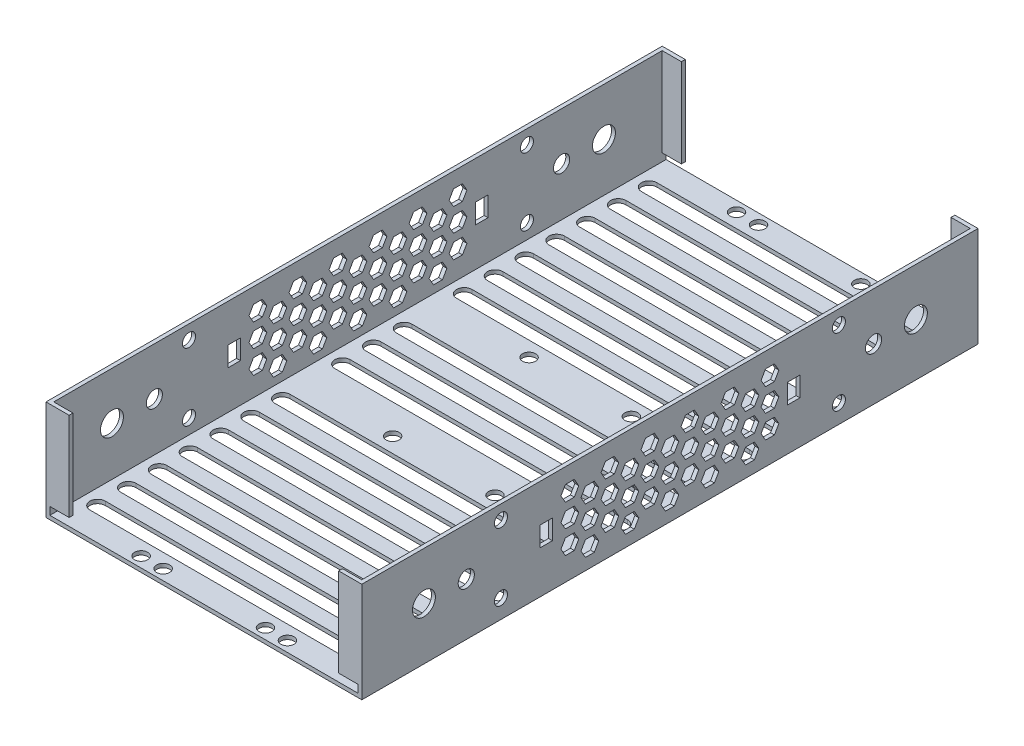
from build123d import *

# Parameters (mm, degrees)
EXTRUDE_START       = 1
SKETCH_1_R          = 1.7
EXTRUDE_1_DEPTH     = 1
SKETCH_3_W          = 160
SKETCH_3_H          = 26
SKETCH_3_R          = 2.98
SKETCH_3_R_2        = 2.1
SKETCH_3_R_3        = 1.7
SKETCH_3_W_2        = 3.245395601
SKETCH_3_H_2        = 5.116955501
EXTRUDE_2_DEPTH     = 1
EXTRUDE_START_2     = -1
SKETCH_11_W         = 160
SKETCH_11_H         = 26
SKETCH_11_R         = 2.98
SKETCH_11_R_2       = 2.1
SKETCH_11_R_3       = 1.7
SKETCH_11_W_2       = 3.245395601
SKETCH_11_H_2       = 5.116955501
EXTRUDE_3_DEPTH     = 1
CUT_EXTRUDE_1_DEPTH = 10
SKETCH_14_W         = 5
SKETCH_14_H         = 23
EXTRUDE_4_DEPTH     = 1
SKETCH_15_W         = 5
SKETCH_15_H         = 23
EXTRUDE_5_DEPTH     = 1
CUT_EXTRUDE_2_DEPTH = 118.698768048


with BuildPart() as part:
    # 草图1 → 凸台-拉伸1 (new body)
    with BuildSketch(Plane(origin=(0, 0, 0), x_dir=(1, 0, 0), z_dir=(0, 1, 0)).offset(EXTRUDE_START)):
        Polygon((-40, 80), (40, 80), (40, -80), (0, -80), (-40, -80), align=None)
        with Locations((-13.28422657, -77.29489459)):
            Circle(SKETCH_1_R, mode=Mode.SUBTRACT)
        with Locations((-13.28422657, -17.70637541)):
            Circle(SKETCH_1_R, mode=Mode.SUBTRACT)
        with Locations((-13.28422657, 77.29489459)):
            Circle(SKETCH_1_R, mode=Mode.SUBTRACT)
        with Locations((-13.28422657, 17.70637541)):
            Circle(SKETCH_1_R, mode=Mode.SUBTRACT)
        with Locations((13.28422657, -77.29489459)):
            Circle(SKETCH_1_R, mode=Mode.SUBTRACT)
        with Locations((13.28422657, -17.70637541)):
            Circle(SKETCH_1_R, mode=Mode.SUBTRACT)
        with Locations((13.28422657, 17.70637541)):
            Circle(SKETCH_1_R, mode=Mode.SUBTRACT)
        with Locations((13.28422657, 77.29489459)):
            Circle(SKETCH_1_R, mode=Mode.SUBTRACT)
        with Locations((19, -77.3)):
            Circle(SKETCH_1_R, mode=Mode.SUBTRACT)
        with Locations((-19, -77.3)):
            Circle(SKETCH_1_R, mode=Mode.SUBTRACT)
        with Locations((19, 77.3)):
            Circle(SKETCH_1_R, mode=Mode.SUBTRACT)
        with Locations((-19, 77.3)):
            Circle(SKETCH_1_R, mode=Mode.SUBTRACT)
    extrude(amount=EXTRUDE_1_DEPTH)

    # 草图3 → 凸台-拉伸2 (add)
    with BuildSketch(Plane(origin=(40, 0, 0), x_dir=(0, 0, -1), z_dir=(1, 0, 0))):
        with Locations((0, 14)):
            Rectangle(SKETCH_3_W, SKETCH_3_H)
        with Locations((-63.873360894, 14.599788345)):
            Circle(SKETCH_3_R, mode=Mode.SUBTRACT)
        with Locations((-52.873360894, 14.599788345)):
            Circle(SKETCH_3_R_2, mode=Mode.SUBTRACT)
        with Locations((52.873360894, 14.599788345)):
            Circle(SKETCH_3_R_2, mode=Mode.SUBTRACT)
        with Locations((63.873360894, 14.599788345)):
            Circle(SKETCH_3_R, mode=Mode.SUBTRACT)
        with Locations((-43.86924386, 23.36782364)):
            Circle(SKETCH_3_R_3, mode=Mode.SUBTRACT)
        with Locations((-43.86924386, 5.83175305)):
            Circle(SKETCH_3_R_3, mode=Mode.SUBTRACT)
        with Locations((43.86924386, 5.83175305)):
            Circle(SKETCH_3_R_3, mode=Mode.SUBTRACT)
        with Locations((43.86924386, 23.36782364)):
            Circle(SKETCH_3_R_3, mode=Mode.SUBTRACT)
        with Locations((-32.136303875, 14.600665152)):
            Rectangle(SKETCH_3_W_2, SKETCH_3_H_2, mode=Mode.SUBTRACT)
        with Locations((32.136303875, 14.600665152)):
            Rectangle(SKETCH_3_W_2, SKETCH_3_H_2, mode=Mode.SUBTRACT)
    extrude(amount=EXTRUDE_2_DEPTH)

    # 草图11 → 凸台-拉伸3 (add)
    with BuildSketch(Plane(origin=(-40, 0, -40), x_dir=(0, 0, -1), z_dir=(1, 0, 0)).offset(EXTRUDE_START_2)):
        with Locations((-40, 14)):
            Rectangle(SKETCH_11_W, SKETCH_11_H)
        with Locations((-103.873360894, 14.599788345)):
            Circle(SKETCH_11_R, mode=Mode.SUBTRACT)
        with Locations((-92.873360894, 14.599788345)):
            Circle(SKETCH_11_R_2, mode=Mode.SUBTRACT)
        with Locations((12.873360894, 14.599788345)):
            Circle(SKETCH_11_R_2, mode=Mode.SUBTRACT)
        with Locations((23.873360894, 14.599788345)):
            Circle(SKETCH_11_R, mode=Mode.SUBTRACT)
        with Locations((-83.86924386, 23.36782364)):
            Circle(SKETCH_11_R_3, mode=Mode.SUBTRACT)
        with Locations((-83.86924386, 5.83175305)):
            Circle(SKETCH_11_R_3, mode=Mode.SUBTRACT)
        with Locations((3.86924386, 5.83175305)):
            Circle(SKETCH_11_R_3, mode=Mode.SUBTRACT)
        with Locations((3.86924386, 23.36782364)):
            Circle(SKETCH_11_R_3, mode=Mode.SUBTRACT)
        with Locations((-72.136303875, 14.600665152)):
            Rectangle(SKETCH_11_W_2, SKETCH_11_H_2, mode=Mode.SUBTRACT)
        with Locations((-7.863696126, 14.600665152)):
            Rectangle(SKETCH_11_W_2, SKETCH_11_H_2, mode=Mode.SUBTRACT)
    extrude(amount=EXTRUDE_3_DEPTH)

    # 草图12 → 切除-拉伸1 (cut)
    with BuildSketch(Plane(origin=(0, 0, 0), x_dir=(1, 0, 0), z_dir=(0, 1, 0))):
        with BuildLine():
            Line((36, 61.605861208), (-36, 61.605861208))
            ThreePointArc((-36, 61.605861208), (-38, 63.605861208), (-36, 65.605861208))
            Line((-36, 65.605861208), (36, 65.605861208))
            ThreePointArc((36, 65.605861208), (38, 63.605861208), (36, 61.605861208))
        make_face()
        with BuildLine():
            Line((36, -2), (-36, -2))
            ThreePointArc((-36, -2), (-38, 0), (-36, 2))
            Line((-36, 2), (36, 2))
            ThreePointArc((36, 2), (38, 0), (36, -2))
        make_face()
        with BuildLine():
            Line((36, 69.605861208), (-36, 69.605861208))
            ThreePointArc((-36, 69.605861208), (-38, 71.605861208), (-36, 73.605861208))
            Line((-36, 73.605861208), (36, 73.605861208))
            ThreePointArc((36, 73.605861208), (38, 71.605861208), (36, 69.605861208))
        make_face()
        with BuildLine():
            Line((36, 53.605861208), (-36, 53.605861208))
            ThreePointArc((-36, 53.605861208), (-38, 55.605861208), (-36, 57.605861208))
            Line((-36, 57.605861208), (36, 57.605861208))
            ThreePointArc((36, 57.605861208), (38, 55.605861208), (36, 53.605861208))
        make_face()
        with BuildLine():
            Line((36, 45.605861208), (-36, 45.605861208))
            ThreePointArc((-36, 45.605861208), (-38, 47.605861208), (-36, 49.605861208))
            Line((-36, 49.605861208), (36, 49.605861208))
            ThreePointArc((36, 49.605861208), (38, 47.605861208), (36, 45.605861208))
        make_face()
        with BuildLine():
            Line((36, 37.605861208), (-36, 37.605861208))
            ThreePointArc((-36, 37.605861208), (-38, 39.605861208), (-36, 41.605861208))
            Line((-36, 41.605861208), (36, 41.605861208))
            ThreePointArc((36, 41.605861208), (38, 39.605861208), (36, 37.605861208))
        make_face()
        with BuildLine():
            Line((36, 29.605861208), (-36, 29.605861208))
            ThreePointArc((-36, 29.605861208), (-38, 31.605861208), (-36, 33.605861208))
            Line((-36, 33.605861208), (36, 33.605861208))
            ThreePointArc((36, 33.605861208), (38, 31.605861208), (36, 29.605861208))
        make_face()
        with BuildLine():
            Line((36, 21.605861208), (-36, 21.605861208))
            ThreePointArc((-36, 21.605861208), (-38, 23.605861208), (-36, 25.605861208))
            Line((-36, 25.605861208), (36, 25.605861208))
            ThreePointArc((36, 25.605861208), (38, 23.605861208), (36, 21.605861208))
        make_face()
        with BuildLine():
            Line((36, -61.605861208), (-36, -61.605861208))
            ThreePointArc((-36, -61.605861208), (-38, -63.605861208), (-36, -65.605861208))
            Line((-36, -65.605861208), (36, -65.605861208))
            ThreePointArc((36, -65.605861208), (38, -63.605861208), (36, -61.605861208))
        make_face()
        with BuildLine():
            Line((36, -69.605861208), (-36, -69.605861208))
            ThreePointArc((-36, -69.605861208), (-38, -71.605861208), (-36, -73.605861208))
            Line((-36, -73.605861208), (36, -73.605861208))
            ThreePointArc((36, -73.605861208), (38, -71.605861208), (36, -69.605861208))
        make_face()
        with BuildLine():
            Line((36, -53.605861208), (-36, -53.605861208))
            ThreePointArc((-36, -53.605861208), (-38, -55.605861208), (-36, -57.605861208))
            Line((-36, -57.605861208), (36, -57.605861208))
            ThreePointArc((36, -57.605861208), (38, -55.605861208), (36, -53.605861208))
        make_face()
        with BuildLine():
            Line((36, -45.605861208), (-36, -45.605861208))
            ThreePointArc((-36, -45.605861208), (-38, -47.605861208), (-36, -49.605861208))
            Line((-36, -49.605861208), (36, -49.605861208))
            ThreePointArc((36, -49.605861208), (38, -47.605861208), (36, -45.605861208))
        make_face()
        with BuildLine():
            Line((36, -37.605861208), (-36, -37.605861208))
            ThreePointArc((-36, -37.605861208), (-38, -39.605861208), (-36, -41.605861208))
            Line((-36, -41.605861208), (36, -41.605861208))
            ThreePointArc((36, -41.605861208), (38, -39.605861208), (36, -37.605861208))
        make_face()
        with BuildLine():
            Line((36, -29.605861208), (-36, -29.605861208))
            ThreePointArc((-36, -29.605861208), (-38, -31.605861208), (-36, -33.605861208))
            Line((-36, -33.605861208), (36, -33.605861208))
            ThreePointArc((36, -33.605861208), (38, -31.605861208), (36, -29.605861208))
        make_face()
        with BuildLine():
            Line((36, -21.605861208), (-36, -21.605861208))
            ThreePointArc((-36, -21.605861208), (-38, -23.605861208), (-36, -25.605861208))
            Line((-36, -25.605861208), (36, -25.605861208))
            ThreePointArc((36, -25.605861208), (38, -23.605861208), (36, -21.605861208))
        make_face()
        with BuildLine():
            Line((36, -10), (-36, -10))
            ThreePointArc((-36, -10), (-38, -8), (-36, -6))
            Line((-36, -6), (36, -6))
            ThreePointArc((36, -6), (38, -8), (36, -10))
        make_face()
        with BuildLine():
            Line((36, 6), (-36, 6))
            ThreePointArc((-36, 6), (-38, 8), (-36, 10))
            Line((-36, 10), (36, 10))
            ThreePointArc((36, 10), (38, 8), (36, 6))
        make_face()
    extrude(amount=CUT_EXTRUDE_1_DEPTH, mode=Mode.SUBTRACT)

    # 草图14 → 凸台-拉伸4 (add)
    with BuildSketch(Plane.XY.offset(80)):
        with Locations((-37.5, 15.5)):
            Rectangle(SKETCH_14_W, SKETCH_14_H)
        with Locations((37.5, 15.5)):
            Rectangle(SKETCH_14_W, SKETCH_14_H)
    extrude(amount=-EXTRUDE_4_DEPTH)

    # 草图15 → 凸台-拉伸5 (add)
    with BuildSketch(Plane(origin=(0, 0, -80), x_dir=(-1, 0, 0), z_dir=(0, 0, -1))):
        with Locations((-37.5, 15.5)):
            Rectangle(SKETCH_15_W, SKETCH_15_H)
        with Locations((37.5, 15.5)):
            Rectangle(SKETCH_15_W, SKETCH_15_H)
    extrude(amount=-EXTRUDE_5_DEPTH)

    # 草图17 → 切除-拉伸2 (cut, through all)
    with BuildSketch(Plane(origin=(41, 0, 0), x_dir=(0, 0, -1), z_dir=(1, 0, 0))):
        Polygon((12.701705922, 6), (11.547005384, 8), (9.237604307, 8), (8.082903769, 6), (9.237604307, 4), (11.547005384, 4), align=None)
        Polygon((17.897858345, 9), (16.743157806, 11), (14.43375673, 11), (13.279056191, 9), (14.43375673, 7), (16.743157806, 7), align=None)
        Polygon((23.094010768, 12), (21.939310229, 14), (19.629909152, 14), (18.475208614, 12), (19.629909152, 10), (21.939310229, 10), align=None)
        Polygon((28.29016319, 15), (27.135462652, 17), (24.826061575, 17), (23.671361037, 15), (24.826061575, 13), (27.135462652, 13), align=None)
        Polygon((2.309401077, 6), (1.154700538, 8), (-1.154700538, 8), (-2.309401077, 6), (-1.154700538, 4), (1.154700538, 4), align=None)
        Polygon((7.505553499, 9), (6.350852961, 11), (4.041451884, 11), (2.886751346, 9), (4.041451884, 7), (6.350852961, 7), align=None)
        Polygon((12.701705922, 12), (11.547005384, 14), (9.237604307, 14), (8.082903769, 12), (9.237604307, 10), (11.547005384, 10), align=None)
        Polygon((17.897858345, 15), (16.743157806, 17), (14.43375673, 17), (13.279056191, 15), (14.43375673, 13), (16.743157806, 13), align=None)
        Polygon((23.094010768, 18), (21.939310229, 20), (19.629909152, 20), (18.475208614, 18), (19.629909152, 16), (21.939310229, 16), align=None)
        Polygon((2.309401077, 12), (1.154700538, 14), (-1.154700538, 14), (-2.309401077, 12), (-1.154700538, 10), (1.154700538, 10), align=None)
        Polygon((7.505553499, 15), (6.350852961, 17), (4.041451884, 17), (2.886751346, 15), (4.041451884, 13), (6.350852961, 13), align=None)
        Polygon((12.701705922, 18), (11.547005384, 20), (9.237604307, 20), (8.082903769, 18), (9.237604307, 16), (11.547005384, 16), align=None)
        Polygon((17.897858345, 21), (16.743157806, 23), (14.43375673, 23), (13.279056191, 21), (14.43375673, 19), (16.743157806, 19), align=None)
        Polygon((2.309401077, 18), (1.154700538, 20), (-1.154700538, 20), (-2.309401077, 18), (-1.154700538, 16), (1.154700538, 16), align=None)
        Polygon((7.505553499, 21), (6.350852961, 23), (4.041451884, 23), (2.886751346, 21), (4.041451884, 19), (6.350852961, 19), align=None)
        Polygon((28.29016319, 21), (27.135462652, 23), (24.826061575, 23), (23.671361037, 21), (24.826061575, 19), (27.135462652, 19), align=None)
        Polygon((-27.135462652, 7), (-28.29016319, 9), (-27.135462652, 11), (-24.826061575, 11), (-23.671361037, 9), (-24.826061575, 7), align=None)
        Polygon((-21.939310229, 4), (-23.094010768, 6), (-21.939310229, 8), (-19.629909152, 8), (-18.475208614, 6), (-19.629909152, 4), align=None)
        Polygon((23.094010768, 6), (21.939310229, 8), (19.629909152, 8), (18.475208614, 6), (19.629909152, 4), (21.939310229, 4), align=None)
        Polygon((28.29016319, 9), (27.135462652, 11), (24.826061575, 11), (23.671361037, 9), (24.826061575, 7), (27.135462652, 7), align=None)
        Polygon((-27.135462652, 19), (-28.29016319, 21), (-27.135462652, 23), (-24.826061575, 23), (-23.671361037, 21), (-24.826061575, 19), align=None)
        Polygon((-6.350852961, 19), (-7.505553499, 21), (-6.350852961, 23), (-4.041451884, 23), (-2.886751346, 21), (-4.041451884, 19), align=None)
        Polygon((-16.743157806, 19), (-17.897858345, 21), (-16.743157806, 23), (-14.43375673, 23), (-13.279056191, 21), (-14.43375673, 19), align=None)
        Polygon((-11.547005384, 16), (-12.701705922, 18), (-11.547005384, 20), (-9.237604307, 20), (-8.082903769, 18), (-9.237604307, 16), align=None)
        Polygon((-6.350852961, 13), (-7.505553499, 15), (-6.350852961, 17), (-4.041451884, 17), (-2.886751346, 15), (-4.041451884, 13), align=None)
        Polygon((-21.939310229, 16), (-23.094010768, 18), (-21.939310229, 20), (-19.629909152, 20), (-18.475208614, 18), (-19.629909152, 16), align=None)
        Polygon((-16.743157806, 13), (-17.897858345, 15), (-16.743157806, 17), (-14.43375673, 17), (-13.279056191, 15), (-14.43375673, 13), align=None)
        Polygon((-11.547005384, 10), (-12.701705922, 12), (-11.547005384, 14), (-9.237604307, 14), (-8.082903769, 12), (-9.237604307, 10), align=None)
        Polygon((-6.350852961, 7), (-7.505553499, 9), (-6.350852961, 11), (-4.041451884, 11), (-2.886751346, 9), (-4.041451884, 7), align=None)
        Polygon((-27.135462652, 13), (-28.29016319, 15), (-27.135462652, 17), (-24.826061575, 17), (-23.671361037, 15), (-24.826061575, 13), align=None)
        Polygon((-21.939310229, 10), (-23.094010768, 12), (-21.939310229, 14), (-19.629909152, 14), (-18.475208614, 12), (-19.629909152, 10), align=None)
        Polygon((-16.743157806, 7), (-17.897858345, 9), (-16.743157806, 11), (-14.43375673, 11), (-13.279056191, 9), (-14.43375673, 7), align=None)
        Polygon((-11.547005384, 4), (-12.701705922, 6), (-11.547005384, 8), (-9.237604307, 8), (-8.082903769, 6), (-9.237604307, 4), align=None)
    extrude(amount=-CUT_EXTRUDE_2_DEPTH, mode=Mode.SUBTRACT)


solid = part.part
